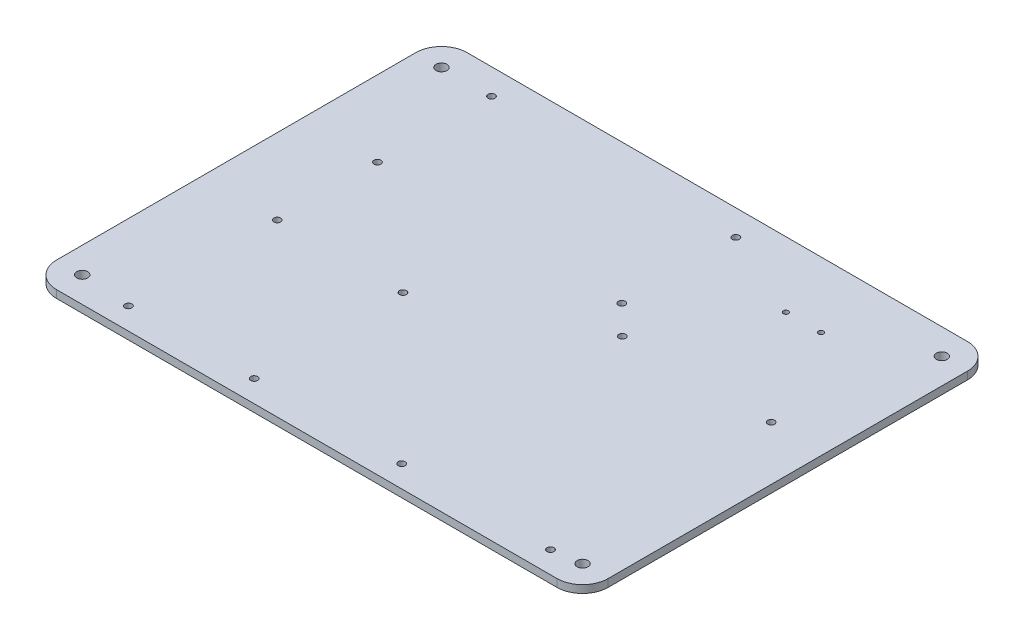
from build123d import *

# Parameters (mm, degrees)
SKETCH1_W           = 215
SKETCH1_H           = 160
BOSS_EXTRUDE1_DEPTH = 3
SKETCH2_R           = 1.35
SKETCH2_R_2         = 1
SKETCH2_R_3         = 2.125
CUT_EXTRUDE1_DEPTH  = 135.034510481
FILLET1_R           = 10


with BuildPart() as part:
    # Sketch1 → Boss-Extrude1 (new body)
    with BuildSketch(Plane(origin=(0, 210, 0), x_dir=(1, 0, 0), z_dir=(0, 1, 0))):
        Rectangle(SKETCH1_W, SKETCH1_H)
    extrude(amount=BOSS_EXTRUDE1_DEPTH)

    # Sketch2 → Cut-Extrude1 (cut, through all)
    with BuildSketch(Plane(origin=(0, 213, 0), x_dir=(1, 0, 0), z_dir=(0, 1, 0))):
        with Locations((-78, -13.5)):
            Circle(SKETCH2_R)
        with Locations((-29, -13.5)):
            Circle(SKETCH2_R)
        with Locations((-29, -71.5)):
            Circle(SKETCH2_R)
        with Locations((-78, -71.5)):
            Circle(SKETCH2_R)
        with Locations((86.5, 14.5)):
            Circle(SKETCH2_R)
        with Locations((86.5, -71.5)):
            Circle(SKETCH2_R)
        with Locations((28.5, -71.5)):
            Circle(SKETCH2_R)
        with Locations((28.5, 14.5)):
            Circle(SKETCH2_R)
        with Locations((-78, 70)):
            Circle(SKETCH2_R)
        with Locations((-78, 25.55)):
            Circle(SKETCH2_R)
        with Locations((17.25, 25.55)):
            Circle(SKETCH2_R)
        with Locations((17.25, 70)):
            Circle(SKETCH2_R)
        with Locations((52.25, 54.5)):
            Circle(SKETCH2_R_2)
        with Locations((65.95, 54.5)):
            Circle(SKETCH2_R_2)
        with Locations((97.5, -70)):
            Circle(SKETCH2_R_3)
        with Locations((97.5, 70)):
            Circle(SKETCH2_R_3)
        with Locations((-97.5, 70)):
            Circle(SKETCH2_R_3)
        with Locations((-97.5, -70)):
            Circle(SKETCH2_R_3)
    extrude(amount=-CUT_EXTRUDE1_DEPTH, mode=Mode.SUBTRACT)

    # Fillet1
    fillet1_edges = [part.edges().sort_by_distance(p)[0] for p in [
        (-107.5, 211.5, 80),
        (107.5, 211.5, 80),
        (107.5, 211.5, -80),
        (-107.5, 211.5, -80),
    ]]
    fillet(fillet1_edges, radius=FILLET1_R)


solid = part.part
